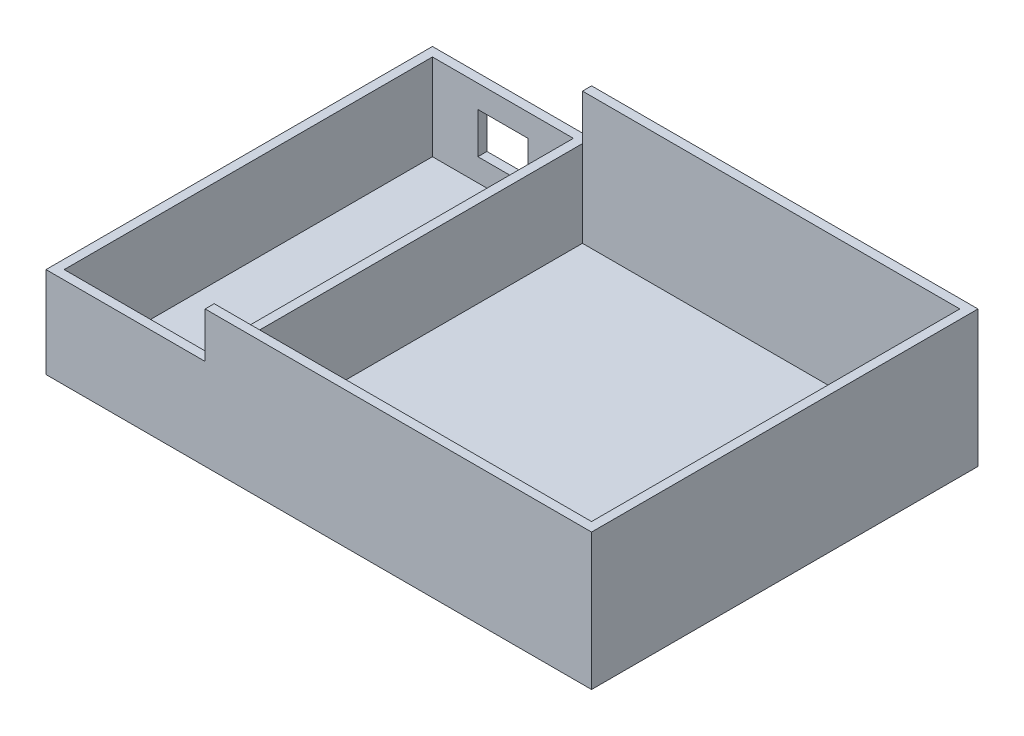
from build123d import *

# Parameters (mm, degrees)
SKETCH1_W           = 120
SKETCH1_H           = 85
BOSS_EXTRUDE1_DEPTH = 30
SKETCH2_W           = 83
SKETCH2_H           = 81
CUT_EXTRUDE1_DEPTH  = 29
SKETCH3_W           = 31
SKETCH3_H           = 81
CUT_EXTRUDE2_DEPTH  = 29
SKETCH4_W           = 35
SKETCH4_H           = 85
CUT_EXTRUDE3_DEPTH  = 10
SKETCH5_W           = 11
SKETCH5_H           = 9
CUT_EXTRUDE4_DEPTH  = 107.719257868


with BuildPart() as part:
    # Sketch1 → Boss-Extrude1 (new body)
    with BuildSketch(Plane(origin=(0, 0, 0), x_dir=(1, 0, 0), z_dir=(0, 1, 0))):
        Rectangle(SKETCH1_W, SKETCH1_H)
    extrude(amount=BOSS_EXTRUDE1_DEPTH)

    # Sketch2 → Cut-Extrude1 (cut)
    with BuildSketch(Plane(origin=(0, 30, 0), x_dir=(1, 0, 0), z_dir=(0, 1, 0))):
        with Locations((16.5, 0)):
            Rectangle(SKETCH2_W, SKETCH2_H)
    extrude(amount=-CUT_EXTRUDE1_DEPTH, mode=Mode.SUBTRACT)

    # Sketch3 → Cut-Extrude2 (cut)
    with BuildSketch(Plane(origin=(0, 30, 0), x_dir=(1, 0, 0), z_dir=(0, 1, 0))):
        with Locations((-42.5, 0)):
            Rectangle(SKETCH3_W, SKETCH3_H)
    extrude(amount=-CUT_EXTRUDE2_DEPTH, mode=Mode.SUBTRACT)

    # Sketch4 → Cut-Extrude3 (cut)
    with BuildSketch(Plane(origin=(0, 30, 0), x_dir=(1, 0, 0), z_dir=(0, 1, 0))):
        with Locations((-42.5, 0)):
            Rectangle(SKETCH4_W, SKETCH4_H)
    extrude(amount=-CUT_EXTRUDE3_DEPTH, mode=Mode.SUBTRACT)

    # Sketch5 → Cut-Extrude4 (cut, through all)
    with BuildSketch(Plane.XY.offset(-40.5)):
        with Locations((-42.5, 10.5)):
            Rectangle(SKETCH5_W, SKETCH5_H)
    extrude(amount=-CUT_EXTRUDE4_DEPTH, mode=Mode.SUBTRACT)


solid = part.part
